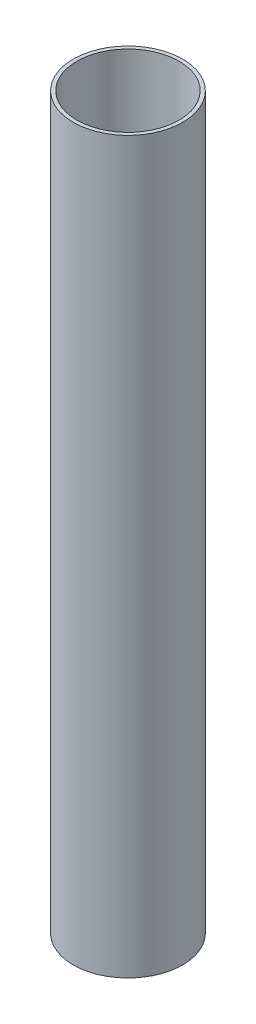
from build123d import *

# Parameters (mm, degrees)
SKETCH1_R           = 19.05
SKETCH1_R_2         = 17.78
BOSS_EXTRUDE1_DEPTH = 254


with BuildPart() as part:
    # Sketch1 → Boss-Extrude1 (new body)
    with BuildSketch(Plane(origin=(0, 0, 0), x_dir=(1, 0, 0), z_dir=(0, 1, 0))):
        Circle(SKETCH1_R)
        Circle(SKETCH1_R_2, mode=Mode.SUBTRACT)
    extrude(amount=BOSS_EXTRUDE1_DEPTH)


solid = part.part
